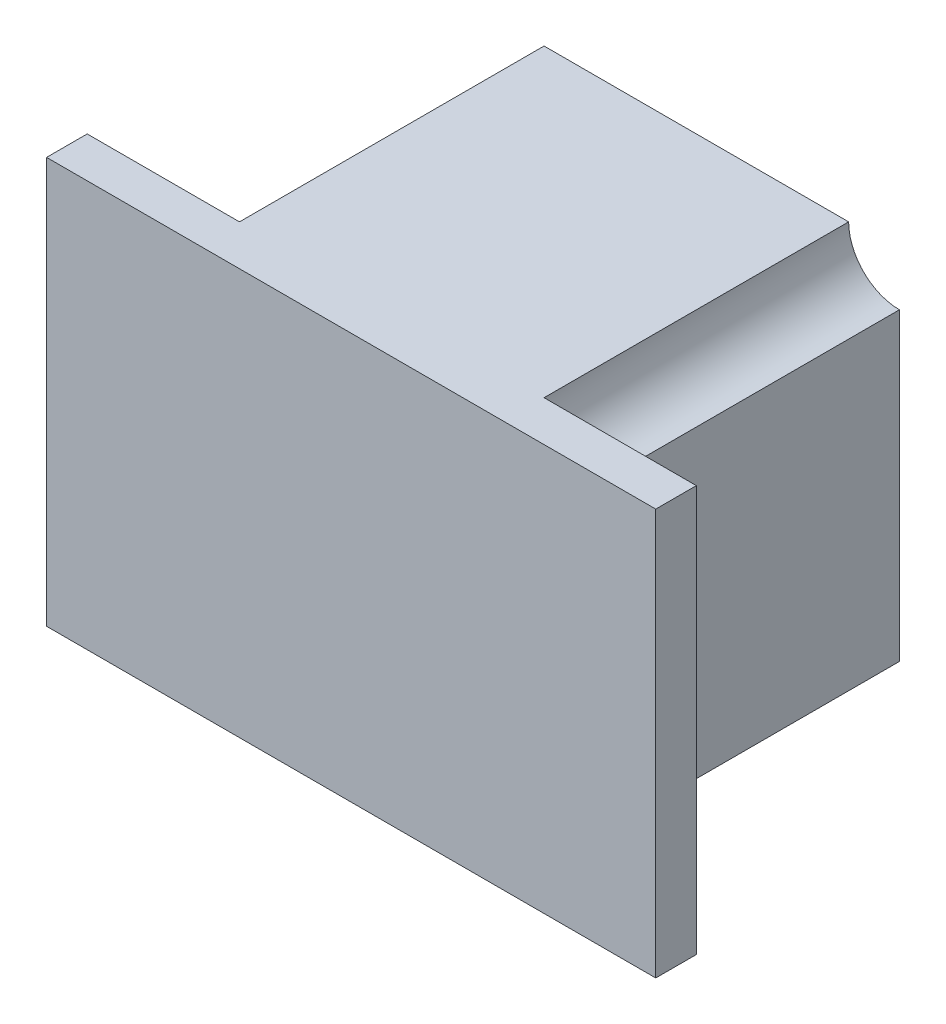
from build123d import *

# Parameters (mm, degrees)
SKETCH1_W           = 300
SKETCH1_H           = 200
BOSS_EXTRUDE1_DEPTH = 20
SKETCH2_W           = 150
SKETCH2_H           = 25
SKETCH2_H_2         = 150
SKETCH2_W_2         = 25
BOSS_EXTRUDE2_DEPTH = 150
FILLET1_R           = 25
FILLET2_R           = 25


with BuildPart() as part:
    # Sketch1 → Boss-Extrude1 (new body)
    with BuildSketch(Plane.XY):
        Rectangle(SKETCH1_W, SKETCH1_H)
    extrude(amount=BOSS_EXTRUDE1_DEPTH)

    # Sketch2 → Boss-Extrude2 (add)
    with BuildSketch(Plane(origin=(0, 0, 0), x_dir=(-1, 0, 0), z_dir=(0, 0, -1))):
        with Locations((0, 87.5)):
            Rectangle(SKETCH2_W, SKETCH2_H)
        Rectangle(SKETCH2_W, SKETCH2_H_2)
        with Locations((-87.5, 0)):
            Rectangle(SKETCH2_W_2, SKETCH2_H_2)
        with Locations((87.5, 0)):
            Rectangle(SKETCH2_W_2, SKETCH2_H_2)
        with Locations((0, -87.5)):
            Rectangle(SKETCH2_W, SKETCH2_H)
    extrude(amount=BOSS_EXTRUDE2_DEPTH)

    # Fillet1
    fillet1_edges = [part.edges().sort_by_distance(p)[0] for p in [
        (75, 75, -75),
    ]]
    fillet(fillet1_edges, radius=FILLET1_R - 0.0001)  # a hair under: the kernel refuses the full size

    # Fillet2
    fillet2_edges = [part.edges().sort_by_distance(p)[0] for p in [
        (75, -75, -75),
        (-75, -75, -75),
        (-75, 75, -75),
    ]]
    fillet(fillet2_edges, radius=FILLET2_R - 0.0001)  # a hair under: the kernel refuses the full size


solid = part.part
